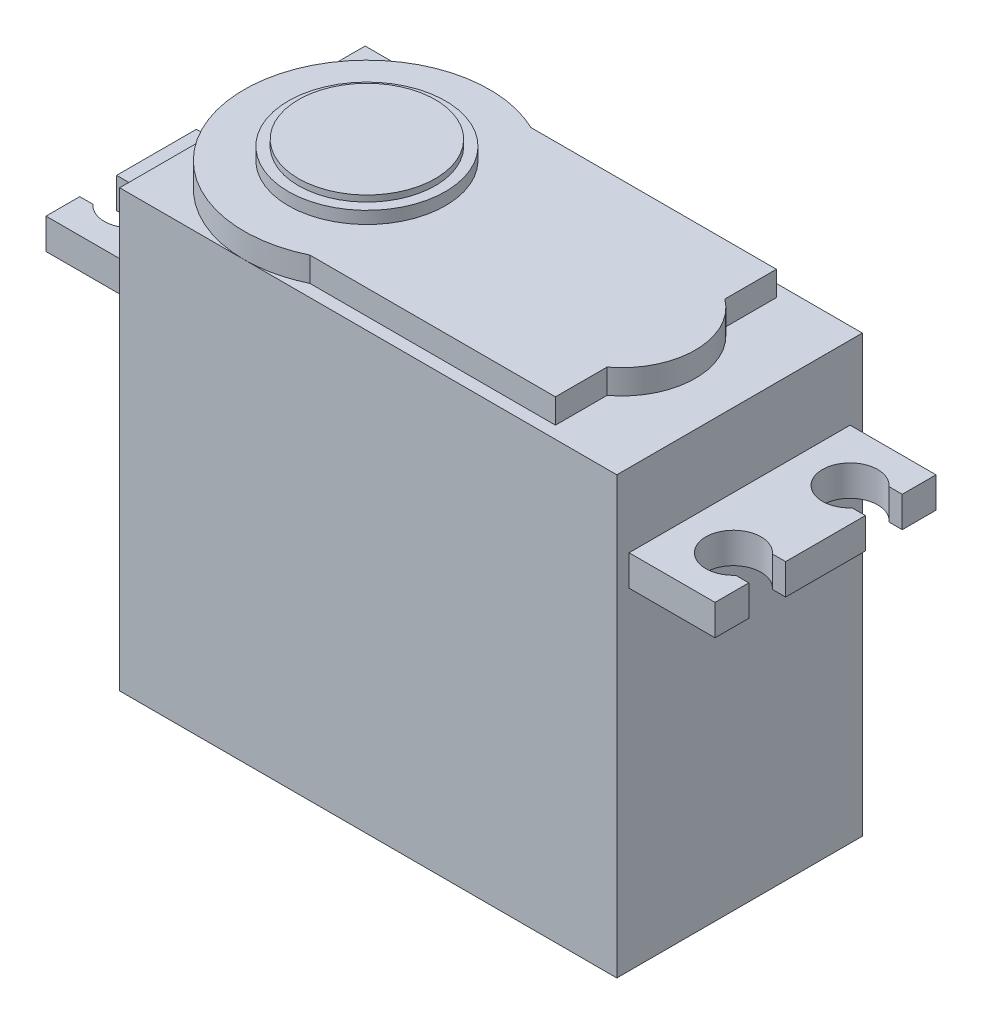
from build123d import *

# Parameters (mm, degrees)
SKETCH1_W            = 40.5
SKETCH1_H            = 20
BOSS_EXTRUDE1_DEPTH  = 35.5
BOSS_EXTRUDE2_DEPTH  = 2
SKETCH3_R            = 6.4
BOSS_EXTRUDE3_DEPTH  = 1
SKETCH4_R            = 5.575
BOSS_EXTRUDE4_DEPTH  = 0.5
BOSS_EXTRUDE5_DEPTH  = 2.5
MIRROR2_COPY_1_DEPTH = 2.5


with BuildPart() as part:
    # Sketch1 → Boss-Extrude1 (new body)
    with BuildSketch(Plane(origin=(0, 0, 0), x_dir=(1, 0, 0), z_dir=(0, 1, 0))):
        Rectangle(SKETCH1_W, SKETCH1_H)
    extrude(amount=BOSS_EXTRUDE1_DEPTH)

    # Sketch2 → Boss-Extrude2 (add)
    with BuildSketch(Plane(origin=(0, 35.5, 0), x_dir=(1, 0, 0), z_dir=(0, 1, 0))):
        with BuildLine():
            Line((-5.75, -9), (14.25, -9))
            Line((14.25, -9), (14.25, -4.8))
            ThreePointArc((14.25, -4.8), (16.65, 0), (14.25, 4.8))
            Line((14.25, 4.8), (14.25, 9))
            Line((14.25, 9), (-5.75, 9))
            ThreePointArc((-5.75, 9), (-20.108898944, 0), (-5.75, -9))
        make_face()
    extrude(amount=BOSS_EXTRUDE2_DEPTH)

    # Sketch3 → Boss-Extrude3 (add)
    with BuildSketch(Plane(origin=(0, 37.5, 0), x_dir=(1, 0, 0), z_dir=(0, 1, 0))):
        with Locations((-10.108898944, 0)):
            Circle(SKETCH3_R)
    extrude(amount=BOSS_EXTRUDE3_DEPTH)

    # Sketch4 → Boss-Extrude4 (add)
    with BuildSketch(Plane(origin=(0, 38.5, 0), x_dir=(1, 0, 0), z_dir=(0, 1, 0))):
        with Locations((-10.108898944, 0)):
            Circle(SKETCH4_R)
    extrude(amount=BOSS_EXTRUDE4_DEPTH)

    # Sketch5 → Boss-Extrude5 (add)
    with BuildSketch(Plane(origin=(0, 29.5, 0), x_dir=(1, 0, 0), z_dir=(0, 1, 0))):
        with BuildLine():
            Line((20.25, 9), (27.25, 9))
            Line((27.25, 9), (27.25, 6.25))
            Line((27.25, 6.25), (26.177050983, 6.25))
            ThreePointArc((26.177050983, 6.25), (22.25, 4.75), (26.177050983, 3.25))
            Line((26.177050983, 3.25), (27.25, 3.25))
            Line((27.25, 3.25), (27.25, 0))
            Line((27.25, 0), (20.25, 0))
            Line((20.25, 0), (20.25, 9))
        make_face()
    boss_extrude5 = extrude(amount=-BOSS_EXTRUDE5_DEPTH)

    # Mirror1: Boss-Extrude5 across plane
    add(boss_extrude5.mirror(Plane(origin=(0, 0, 0), x_dir=(0, 0, 1), z_dir=(1, 0, 0))))

    # Mirror2: Boss-Extrude5 across plane
    add(boss_extrude5.mirror(Plane.XY))

    # Mirror2 copy 1 sketch → Mirror2 copy 1 (add)
    with BuildSketch(Plane(origin=(0, 29.5, 0), x_dir=(-1, 0, 0), z_dir=(0, 1, 0))):
        with BuildLine():
            Line((20.25, 9), (27.25, 9))
            Line((27.25, 9), (27.25, 6.25))
            Line((27.25, 6.25), (26.177050983, 6.25))
            ThreePointArc((26.177050983, 6.25), (22.25, 4.75), (26.177050983, 3.25))
            Line((26.177050983, 3.25), (27.25, 3.25))
            Line((27.25, 3.25), (27.25, 0))
            Line((27.25, 0), (20.25, 0))
            Line((20.25, 0), (20.25, 9))
        make_face()
    extrude(amount=-MIRROR2_COPY_1_DEPTH)


solid = part.part
